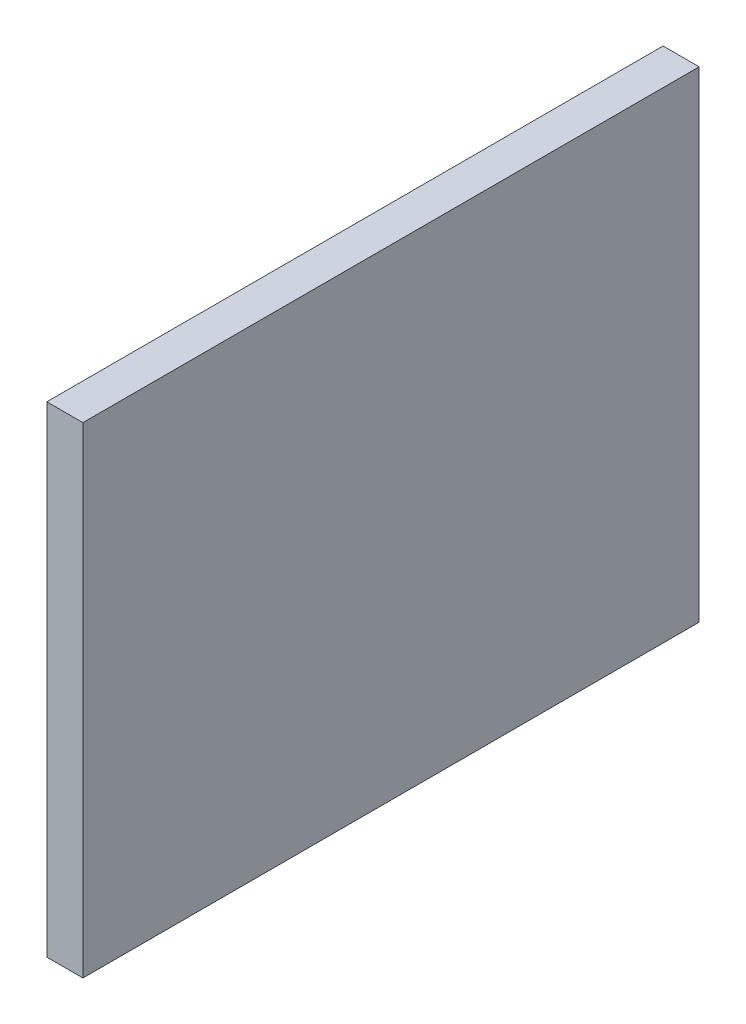
from build123d import *

# Parameters (mm, degrees)
SKETCH1_W           = 76.2
SKETCH1_H           = 1355.725
BOSS_EXTRUDE1_DEPTH = 1016
SKETCH3_W           = 53.975
SKETCH3_H           = 1016
CUT_EXTRUDE2_DEPTH  = 1696.892896272


with BuildPart() as part:
    # Sketch1 → Boss-Extrude1 (new body)
    with BuildSketch(Plane(origin=(0, 0, 0), x_dir=(1, 0, 0), z_dir=(0, 1, 0))):
        with Locations((38.1, -677.8625)):
            Rectangle(SKETCH1_W, SKETCH1_H)
    extrude(amount=BOSS_EXTRUDE1_DEPTH)

    # Sketch3 → Cut-Extrude2 (cut, through all)
    with BuildSketch(Plane.ZY):
        with Locations((1328.7375, 508)):
            Rectangle(SKETCH3_W, SKETCH3_H)
    extrude(amount=-CUT_EXTRUDE2_DEPTH, mode=Mode.SUBTRACT)


solid = part.part
